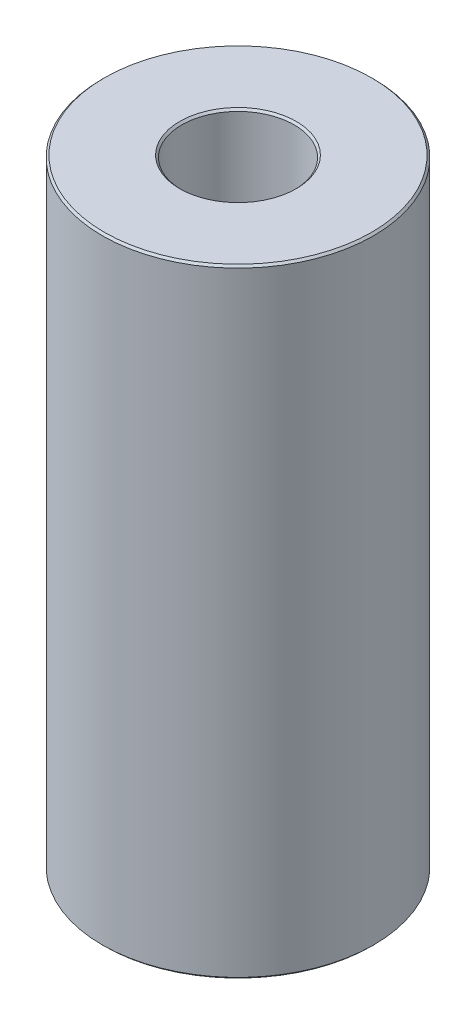
from build123d import *

# Parameters (mm, degrees)
SKETCH1_R           = 47.5
BOSS_EXTRUDE1_DEPTH = 216.38670689
SKETCH2_R           = 19.705061755
CUT_EXTRUDE1_DEPTH  = 227.573844295
CHAMFER1_SIZE       = 0.70021071


with BuildPart() as part:
    # Sketch1 → Boss-Extrude1 (new body)
    with BuildSketch(Plane(origin=(0, 0, 0), x_dir=(1, 0, 0), z_dir=(0, 1, 0))):
        Circle(SKETCH1_R)
    extrude(amount=BOSS_EXTRUDE1_DEPTH)

    # Sketch2 → Cut-Extrude1 (cut, through all)
    with BuildSketch(Plane(origin=(0, 0, 0), x_dir=(1, 0, 0), z_dir=(0, 1, 0))):
        Circle(SKETCH2_R)
    extrude(amount=CUT_EXTRUDE1_DEPTH, mode=Mode.SUBTRACT)

    # Chamfer1
    chamfer1_edges = [part.edges().sort_by_distance(p)[0] for p in [
        (-19.705061755, 216.38670689, 0),
        (-19.705061755, 0, 0),
        (-47.5, 0, 0),
        (-47.5, 216.38670689, 0),
    ]]
    chamfer(chamfer1_edges, length=CHAMFER1_SIZE)


solid = part.part
